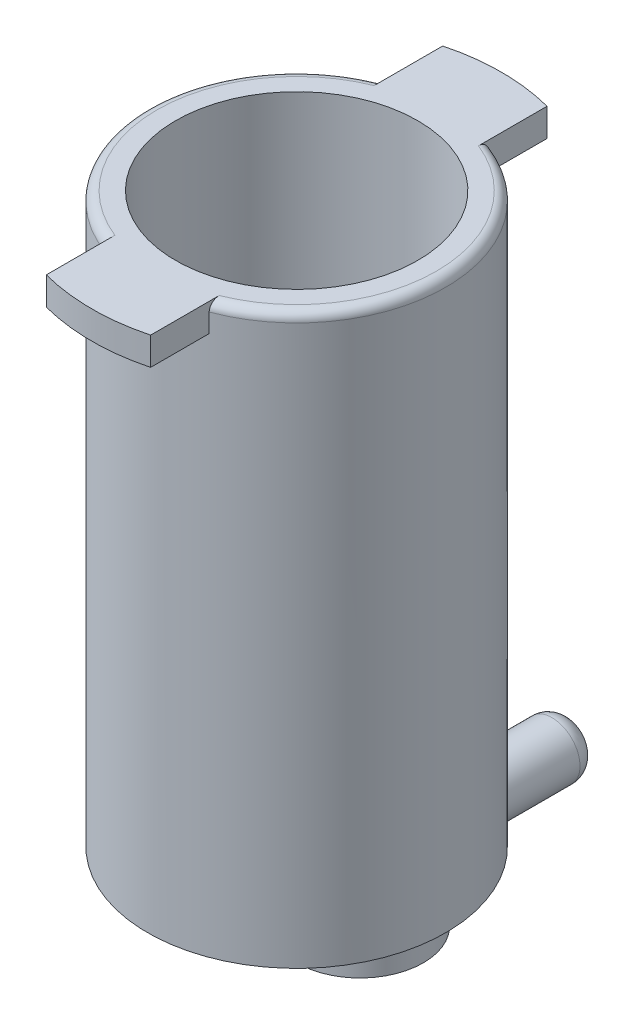
from build123d import *

# Parameters (mm, degrees)
SKETCH1_R           = 8
BOSS_EXTRUDE1_DEPTH = 30.5
SHELL1_T            = -1.5
SKETCH2_R           = 3.4
BOSS_EXTRUDE2_DEPTH = 5.4
SHELL2_START        = -3.9
SHELL2_OUTLINE_R    = 1.9
SHELL2_DEPTH        = 5.4
SKETCH5_R           = 2.45
BOSS_EXTRUDE5_DEPTH = 4.9
SKETCH6_R           = 1.5
BOSS_EXTRUDE6_DEPTH = 6.3
SKETCH7_R           = 0.95
CUT_EXTRUDE1_DEPTH  = 11.3
SKETCH8_R           = 1.9
CUT_EXTRUDE2_DEPTH  = 39.216750365
FILLET1_R           = 1
FILLET2_R           = 0.5
BOSS_EXTRUDE7_START = -1.5
BOSS_EXTRUDE7_DEPTH = 1.5


# Read off the part's stored shape, not the designer's step: Shell2
with BuildPart() as part:
    # Sketch1 → Boss-Extrude1 (new body)
    with BuildSketch(Plane(origin=(0, 0, 0), x_dir=(1, 0, 0), z_dir=(0, 1, 0))):
        with Locations(Location((0, 0, 0), (0, 0, 90))):
            Circle(SKETCH1_R)
    extrude(amount=BOSS_EXTRUDE1_DEPTH)

    # Shell1
    shell1_openings = [part.faces().sort_by_distance(p)[0] for p in [
        (0, 30.5, 0),
    ]]
    offset(amount=SHELL1_T, openings=shell1_openings, kind=Kind.INTERSECTION)

    # Sketch2 → Boss-Extrude2 (add)
    with BuildSketch(Plane.XZ):
        with Locations(Location((0, -3.4, 0), (0, 0, 90))):
            Circle(SKETCH2_R)
    extrude(amount=BOSS_EXTRUDE2_DEPTH)

    # Shell2 outline → Shell2 (cut)
    with BuildSketch(Plane(origin=(0, 0, 0), x_dir=(1, 0, 0), z_dir=(0, 1, 0)).offset(SHELL2_START)):
        with Locations((0, 3.4)):
            Circle(SHELL2_OUTLINE_R)
    extrude(amount=SHELL2_DEPTH, mode=Mode.SUBTRACT)

    # Sketch5 → Boss-Extrude5 (add)
    with BuildSketch(Plane.XY.offset(-3.4)):
        with Locations((0, -2.35384725)):
            Circle(SKETCH5_R)
    extrude(amount=-BOSS_EXTRUDE5_DEPTH)

    # Sketch6 → Boss-Extrude6 (add)
    with BuildSketch(Plane(origin=(0, 0, -8.3), x_dir=(-1, 0, 0), z_dir=(0, 0, -1))):
        with Locations((0, -2.35384725)):
            Circle(SKETCH6_R)
    extrude(amount=BOSS_EXTRUDE6_DEPTH)

    # Sketch7 → Cut-Extrude1 (cut)
    with BuildSketch(Plane(origin=(0, 0, -14.6), x_dir=(-1, 0, 0), z_dir=(0, 0, -1))):
        with Locations((0, -2.35384725)):
            Circle(SKETCH7_R)
    extrude(amount=-CUT_EXTRUDE1_DEPTH, mode=Mode.SUBTRACT)

    # Sketch8 → Cut-Extrude2 (cut, through all)
    with BuildSketch(Plane(origin=(0, -3.9, 0), x_dir=(1, 0, 0), z_dir=(0, 1, 0))):
        with Locations(Location((0, 3.4, 0), (0, 0, 270))):
            Circle(SKETCH8_R)
    extrude(amount=CUT_EXTRUDE2_DEPTH, mode=Mode.SUBTRACT)

    # Fillet1
    # the kernel refuses this fillet: 1 mm, written as the material it takes off along each edge
    with BuildSketch(Plane(origin=(0, -2.35384725, -14.6), x_dir=(-1, 0, 0), z_dir=(0, -1, 0))) as fillet1_piece_1:
        with BuildLine():
            CenterArc((0.5, -0.893028555), FILLET1_R, 0, 63.25631605)
            Line((1.5, -0.893028555), (1.52, -0.893028555))
            Line((1.52, -0.893028555), (1.52, 0))
            Line((1.52, 0), (1.5, 0.02))
            ThreePointArc((1.5, 0.02), (1.225, 0.02), (0.959, 0.017860571))
            Line((0.959, 0.017860571), (0.95, 0))
        make_face()
    revolve(axis=Axis((0, -2.35384725, -14.6), (0, 0, -1)), mode=Mode.SUBTRACT)

    # Fillet2
    fillet2_edges = [part.edges().sort_by_distance(p)[0] for p in [
        (0, 30.5, 8),
    ]]
    fillet(fillet2_edges, radius=FILLET2_R)

    # Sketch9 → Boss-Extrude7 (add)
    with BuildSketch(Plane(origin=(0, 30.5, 0), x_dir=(1, 0, 0), z_dir=(0, 1, 0)).offset(BOSS_EXTRUDE7_START)):
        with BuildLine():
            Line((2.8, 10.637668918), (2.8, 5.86600375))
            ThreePointArc((2.8, 5.86600375), (0, 6.5), (-2.8, 5.86600375))
            Line((-2.8, 5.86600375), (-2.8, 10.637668918))
            ThreePointArc((-2.8, 10.637668918), (0, 11), (2.8, 10.637668918))
        make_face()
        with BuildLine():
            Line((-2.8, -10.637668918), (-2.8, -5.86600375))
            ThreePointArc((-2.8, -5.86600375), (0, -6.5), (2.8, -5.86600375))
            Line((2.8, -5.86600375), (2.8, -10.637668918))
            ThreePointArc((2.8, -10.637668918), (0, -11), (-2.8, -10.637668918))
        make_face()
    extrude(amount=BOSS_EXTRUDE7_DEPTH)


solid = part.part
